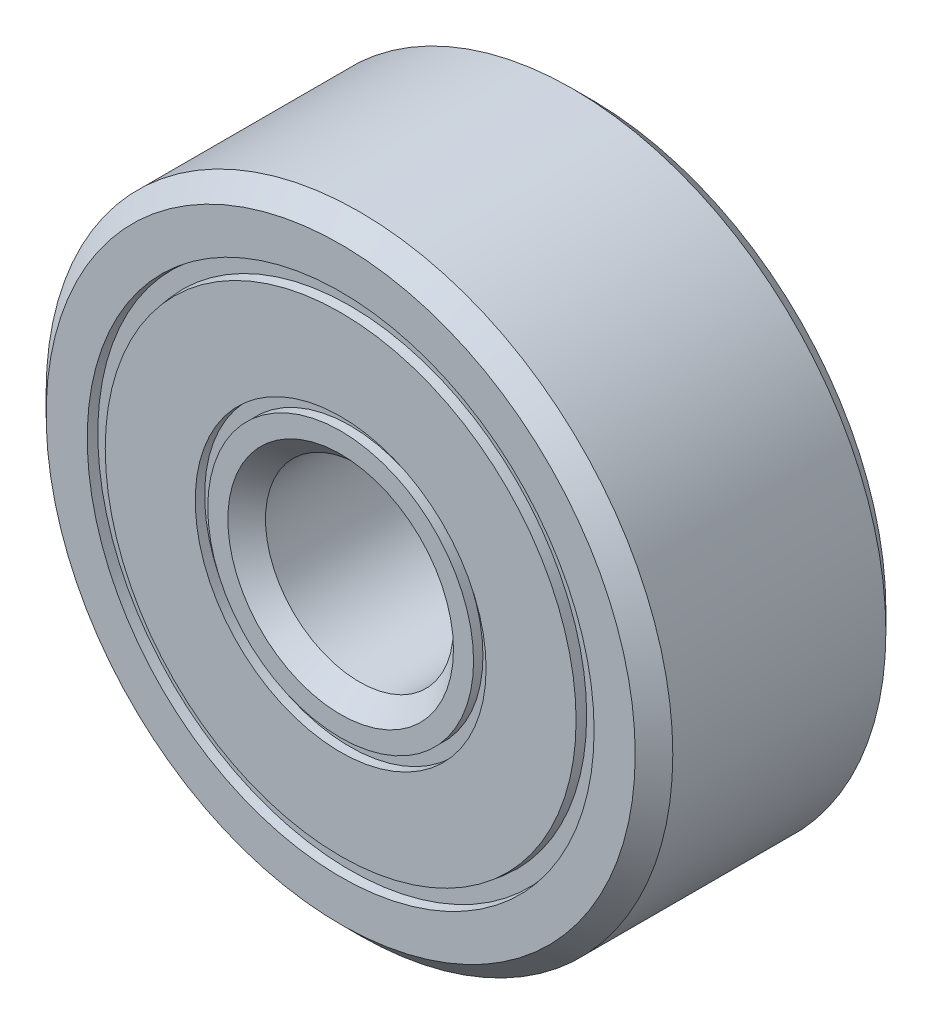
from build123d import *

# Parameters (mm, degrees)
CROQUIS1_R              = 5
CROQUIS1_R_2            = 1.5
SALIENTE_EXTRUIR1_DEPTH = 4
CHAFL_N1_SIZE           = 0.3
CROQUIS2_W              = 1
CROQUIS2_H              = 0.2


with BuildPart() as part:
    # Croquis1 → Saliente-Extruir1 (new body)
    with BuildSketch(Plane.XY):
        Circle(CROQUIS1_R)
        Circle(CROQUIS1_R_2, mode=Mode.SUBTRACT)
    extrude(amount=SALIENTE_EXTRUIR1_DEPTH)

    # Chaflán1
    chafl_n1_edges = [part.edges().sort_by_distance(p)[0] for p in [
        (-5, 0, 0),
        (-5, 0, 4),
        (-1.5, 0, 4),
        (-1.5, 0, 0),
    ]]
    chamfer(chafl_n1_edges, length=CHAFL_N1_SIZE)

    # Croquis2 → Cortar-Revolución1 (revolve, cut)
    with BuildSketch(Plane(origin=(0, 0, 0), x_dir=(0, 0, -1), z_dir=(1, 0, 0))):
        Polygon((-4.85, 4.150466692), (-3.85, 4.025466692), (-3.85, 3.775466692), (-4.85, 3.650466692), align=None)
        Polygon((0.85, 3.650466692), (0.85, 4.150466692), (-0.15, 4.025466692), (-0.15, 3.775466692), align=None)
        with Locations((-4.35, 2.220733596)):
            Rectangle(CROQUIS2_W, CROQUIS2_H)
        with Locations((0.35, 2.220733596)):
            Rectangle(CROQUIS2_W, CROQUIS2_H)
    revolve(axis=Axis((0, 0, 12.411349243), (0, 0, -1)), mode=Mode.SUBTRACT)


solid = part.part
